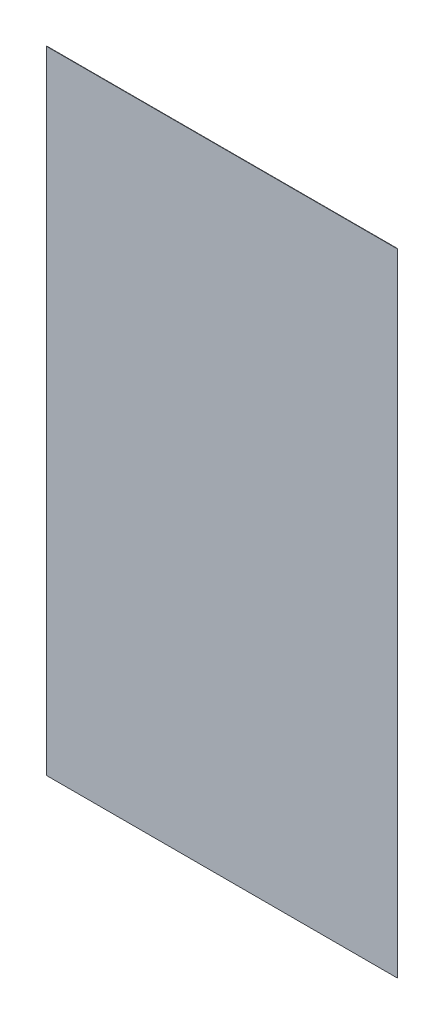
from build123d import *

# Parameters (mm, degrees)
SKETCH1_W           = 903
SKETCH1_H           = 1625
BOSS_EXTRUDE1_DEPTH = 1


with BuildPart() as part:
    # Sketch1 → Boss-Extrude1 (new body)
    with BuildSketch(Plane.XY):
        with Locations((451.5, 812.5)):
            Rectangle(SKETCH1_W, SKETCH1_H)
    extrude(amount=BOSS_EXTRUDE1_DEPTH)


solid = part.part
